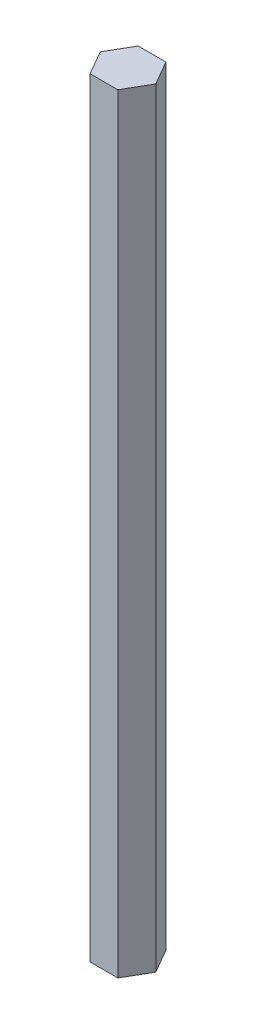
from build123d import *

# Parameters (mm, degrees)
BOSS_EXTRUDE1_DEPTH = 203.2


with BuildPart() as part:
    # Sketch1 → Boss-Extrude1 (new body)
    with BuildSketch(Plane(origin=(0, 0, 0), x_dir=(1, 0, 0), z_dir=(0, 1, 0))):
        Polygon((7.332348419, 0), (3.666174209, 6.35), (-3.666174209, 6.35), (-7.332348419, 0), (-3.666174209, -6.35), (3.666174209, -6.35), align=None)
    extrude(amount=BOSS_EXTRUDE1_DEPTH)


solid = part.part
